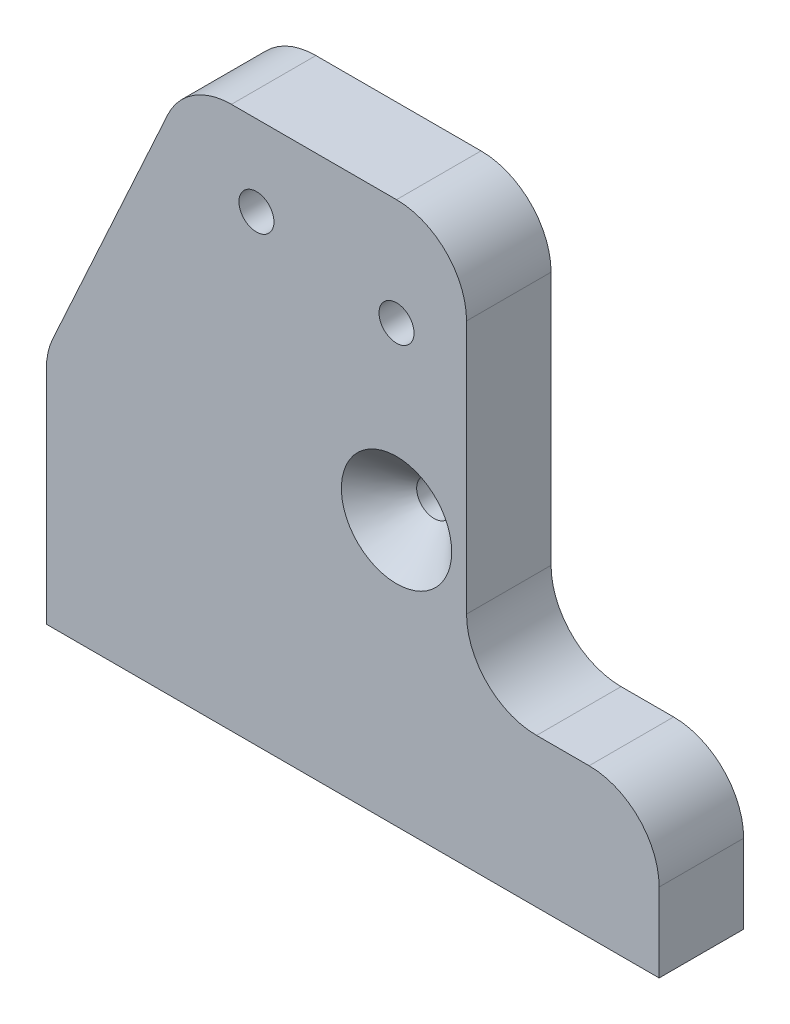
from build123d import *

# Parameters (mm, degrees)
BOSS_EXTRUDE1_DEPTH                             = 4.826
M3X0_5_TAPPED_HOLE2_D                           = 2
M3X0_5_TAPPED_HOLE3_D                           = 2.5
M3X0_5_TAPPED_HOLE3_DEPTH                       = 5
M3X0_5_TAPPED_HOLE3_TIP                         = 0.751075774
FILLET2_R                                       = 4
CUT_EXTRUDE1_DEPTH                              = 10
CSK_FOR_M3_FLAT_HEAD_MACHINE_SCREW1_D           = 2
CSK_FOR_M3_FLAT_HEAD_MACHINE_SCREW1_CSINK_D     = 6.3
CSK_FOR_M3_FLAT_HEAD_MACHINE_SCREW1_CSINK_ANGLE = 90
SKETCH23_R                                      = 1
CUT_EXTRUDE2_DEPTH                              = 48.003087941


with BuildPart() as part:
    # Sketch1 → Boss-Extrude1 (new body)
    with BuildSketch(Plane.XY):
        Polygon((0, 13.5), (0, 0), (35, 0), (35, 8.5), (24, 8.5), (24, 31), (8, 31), align=None)
    extrude(amount=BOSS_EXTRUDE1_DEPTH)

    # M3x0.5 Tapped Hole2 (through all)
    with Locations(Plane.XY.offset(4.826)):
        with Locations((12, 26.4)):
            Hole(M3X0_5_TAPPED_HOLE2_D / 2)

    # M3x0.5 Tapped Hole3
    with Locations(Plane(origin=(0, 0, 0), x_dir=(-1, 0, 0), z_dir=(0, -1, 0))):
        with Locations((-16.73, -2.413), (-28.73, -2.413)):
            Hole(M3X0_5_TAPPED_HOLE3_D / 2, depth=M3X0_5_TAPPED_HOLE3_DEPTH)
            with Locations((0, 0, -(M3X0_5_TAPPED_HOLE3_DEPTH + M3X0_5_TAPPED_HOLE3_TIP / 2))):  # 118° drill point
                Cone(0, M3X0_5_TAPPED_HOLE3_D / 2, M3X0_5_TAPPED_HOLE3_TIP, mode=Mode.SUBTRACT)

    # Fillet2
    fillet2_edges = [part.edges().sort_by_distance(p)[0] for p in [
        (35, 8.5, 2.413),
        (24, 8.5, 2.413),
        (24, 31, 2.413),
        (0, 13.5, 2.413),
        (8, 31, 2.413),
    ]]
    fillet(fillet2_edges, radius=FILLET2_R)

    # Sketch19 → Cut-Extrude1 (cut)
    with BuildSketch(Plane.XY.offset(4.826)):
        with BuildLine():
            ThreePointArc((19, 15.15), (20, 14.15), (21, 15.15))
            ThreePointArc((21, 15.15), (20, 16.15), (19, 15.15))
        make_face()
    extrude(amount=-CUT_EXTRUDE1_DEPTH, mode=Mode.SUBTRACT)

    # CSK for M3 Flat Head Machine Screw1 (through all)
    with Locations(Plane.XY.offset(4.826)):
        with Locations((20, 15.15)):
            CounterSinkHole(CSK_FOR_M3_FLAT_HEAD_MACHINE_SCREW1_D / 2, CSK_FOR_M3_FLAT_HEAD_MACHINE_SCREW1_CSINK_D / 2, counter_sink_angle=CSK_FOR_M3_FLAT_HEAD_MACHINE_SCREW1_CSINK_ANGLE)

    # Sketch23 → Cut-Extrude2 (cut, through all)
    with BuildSketch(Plane.XY.offset(4.826)):
        with Locations((20, 24.9)):
            Circle(SKETCH23_R)
    extrude(amount=-CUT_EXTRUDE2_DEPTH, mode=Mode.SUBTRACT)


solid = part.part
